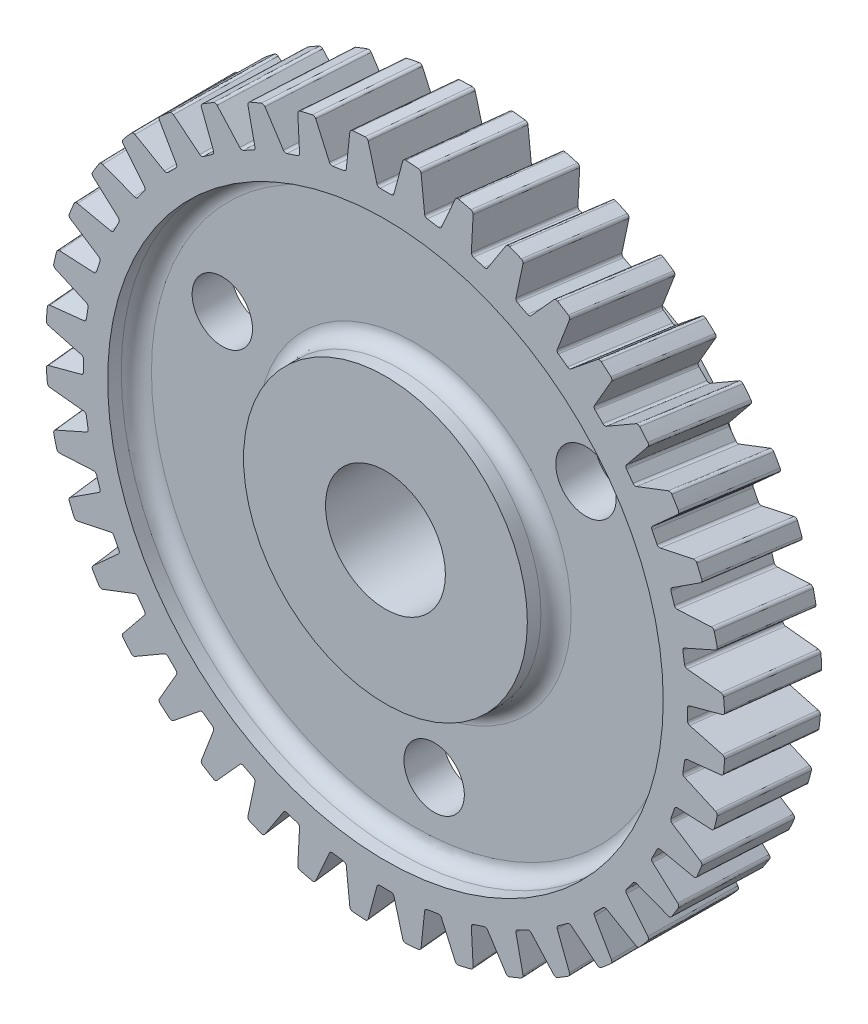
from build123d import *

# Parameters (mm, degrees)
FILLET1_R                = 1
CIRPATTERN1_COUNT        = 40
FILLET2_R                = 0.2
F_4_0_4_DIAMETER_HOLE1_D = 4


with BuildPart() as part:
    # Sketch2 → Revolve1 (revolve)
    with BuildSketch(Plane(origin=(0, 0, 0), x_dir=(0, 0, -1), z_dir=(1, 0, 0))):
        Polygon((11, 3.96875), (-3.2, 3.96875), (-3.2, 9.4), (-1.3, 9.4), (-1.3, 18.4), (-3.2, 18.4), (-3.2, 22.5), (3.2, 22.5), (3.2, 18.4), (1.3, 18.4), (1.3, 9.4), (3.2, 9.4), (11, 9.4), align=None)
    revolve(axis=Axis((0, 0, 0), (0, 0, -1)))

    # Fillet1
    fillet1_edges = [part.edges().sort_by_distance(p)[0] for p in [
        (0, -18.4, 1.3),
        (0, -9.4, 1.3),
        (0, -9.4, -1.3),
        (0, -18.4, -1.3),
    ]]
    fillet(fillet1_edges, radius=FILLET1_R)

    # Cut-Sweep1: sweep along a path in Sketch4
    with BuildLine(Plane(origin=(0, 0, 0), x_dir=(1, 0, 0), z_dir=(0, 1, 0))) as cut_sweep1_path:
        Line((0, -3.2), (0.690971205, 3.2))
    # Sketch3 → Cut-Sweep1 (sweep, cut)
    with BuildSketch(Plane.XY.offset(3.2)):
        Polygon((-0.525, 20), (0.525, 20), (1.246362285, 22.6921607), (-1.246362285, 22.6921607), align=None)
    cut_sweep1 = sweep(path=cut_sweep1_path.line, mode=Mode.SUBTRACT)

    # CirPattern1: Cut-Sweep1 ×40 about axis
    cirpattern1_axis = Axis((0, 0, 3.2), (0, 0, 1))
    for i in range(1, CIRPATTERN1_COUNT):
        add(cut_sweep1.rotate(cirpattern1_axis, i * 360 / CIRPATTERN1_COUNT), mode=Mode.SUBTRACT)

    # Fillet2
    fillet2_edges = [part.edges().sort_by_distance(p)[0] for p in [
        (1.526462518, 22.448160552, 5.3054e-05),
        (0.870485603, 20, 0),
        (-0.845126217, 22.484122435, -6.2808e-05),
        (-2.003996756, 22.410577793, 5.3054e-05),
        (-2.26892082, 19.889940761, 0),
        (-3.305993578, 19.725684573, 0),
        (-4.352012976, 22.07509871, -6.2808e-05),
        (-5.485110979, 21.821172231, 5.3054e-05),
        (-5.352458883, 19.29012517, 0),
        (-6.351068225, 18.965657326, 0),
        (-7.751738732, 21.122512792, -6.2808e-05),
        (-8.831163565, 20.694456989, 5.3054e-05),
        (-8.304201644, 18.215322678, 0),
        (-9.239758494, 17.738632653, 0),
        (-10.960590953, 19.649820507, -6.2808e-05),
        (-11.959763596, 19.058175535, 5.3054e-05),
        (-11.0514674, 16.691998487, 0),
        (-11.900935244, 16.074823972, 0),
        (-13.89955705, 17.693284427, -6.2808e-05),
        (-14.793874554, 16.952618549, 5.3054e-05),
        (-13.526609351, 14.757661896, 0),
        (-14.269071471, 14.015199776, 0),
        (-16.496269922, 15.301080964, -6.2808e-05),
        (-17.263711223, 14.429631832, 5.3054e-05),
        (-15.668681288, 12.459942692, 0),
        (-16.285855803, 11.610474848, 0),
        (-18.68678988, 12.532114106, -6.2808e-05),
        (-19.308458027, 11.55133969, 5.3054e-05),
        (-17.42493829, 9.855418346, 0),
        (-17.901628315, 8.919861496, 0),
        (-20.417179054, 9.454565008, -6.2808e-05),
        (-20.877766513, 8.388615227, 5.3054e-05),
        (-18.752135481, 7.008220892, 0),
        (-19.076603325, 6.00961155, 0),
        (-21.644829518, 6.144213141, -6.2808e-05),
        (-21.932995098, 5.019335218, 5.3054e-05),
        (-19.617592862, 3.988457781, 0),
        (-19.781849051, 2.951385024, 0),
        (-22.339512445, 2.682570354, -6.2808e-05),
        (-22.448160552, 1.526462518, 5.3054e-05),
        (-20, 0.870485603, 0),
        (-20, -0.179514397, 0),
        (-22.484122435, -0.845126217, -6.2808e-05),
        (-22.410577793, -2.003996756, 5.3054e-05),
        (-19.889940761, -2.26892082, 0),
        (-19.725684573, -3.305993578, 0),
        (-22.07509871, -4.352012976, -6.2808e-05),
        (-21.821172231, -5.485110979, 5.3054e-05),
        (-19.29012517, -5.352458883, 0),
        (-18.965657326, -6.351068225, 0),
        (-21.122512792, -7.751738732, -6.2808e-05),
        (-20.694456989, -8.831163565, 5.3054e-05),
        (-18.215322678, -8.304201644, 0),
        (-17.738632653, -9.239758494, 0),
        (-19.649820507, -10.960590953, -6.2808e-05),
        (-19.058175535, -11.959763596, 5.3054e-05),
        (-16.691998487, -11.0514674, 0),
        (-16.074823972, -11.900935244, 0),
        (-17.693284427, -13.89955705, -6.2808e-05),
        (-16.952618549, -14.793874554, 5.3054e-05),
        (-14.757661896, -13.526609351, 0),
        (-14.015199776, -14.269071471, 0),
        (-15.301080964, -16.496269922, -6.2808e-05),
        (-14.429631832, -17.263711223, 5.3054e-05),
        (-12.459942692, -15.668681288, 0),
        (-11.610474848, -16.285855803, 0),
        (-12.532114106, -18.68678988, -6.2808e-05),
        (-11.55133969, -19.308458027, 5.3054e-05),
        (-9.855418346, -17.42493829, 0),
        (-8.919861496, -17.901628315, 0),
        (-9.454565008, -20.417179054, -6.2808e-05),
        (-8.388615227, -20.877766513, 5.3054e-05),
        (-7.008220892, -18.752135481, 0),
        (-6.00961155, -19.076603325, 0),
        (-6.144213141, -21.644829518, -6.2808e-05),
        (-5.019335218, -21.932995098, 5.3054e-05),
        (-3.988457781, -19.617592862, 0),
        (-2.951385024, -19.781849051, 0),
        (-2.682570354, -22.339512445, -6.2808e-05),
        (-1.526462518, -22.448160552, 5.3054e-05),
        (-0.870485603, -20, 0),
        (0.179514397, -20, 0),
        (0.845126217, -22.484122435, -6.2808e-05),
        (2.003996756, -22.410577793, 5.3054e-05),
        (2.26892082, -19.889940761, 0),
        (3.305993578, -19.725684573, 0),
        (4.352012976, -22.07509871, -6.2808e-05),
        (5.485110979, -21.821172231, 5.3054e-05),
        (5.352458883, -19.29012517, 0),
        (6.351068225, -18.965657326, 0),
        (7.751738732, -21.122512792, -6.2808e-05),
        (8.831163565, -20.694456989, 5.3054e-05),
        (8.304201644, -18.215322678, 0),
        (9.239758494, -17.738632653, 0),
        (10.960590953, -19.649820507, -6.2808e-05),
        (11.959763596, -19.058175535, 5.3054e-05),
        (11.0514674, -16.691998487, 0),
        (11.900935244, -16.074823972, 0),
        (13.89955705, -17.693284427, -6.2808e-05),
        (14.793874554, -16.952618549, 5.3054e-05),
        (13.526609351, -14.757661896, 0),
        (14.269071471, -14.015199776, 0),
        (16.496269922, -15.301080964, -6.2808e-05),
        (17.263711223, -14.429631832, 5.3054e-05),
        (15.668681288, -12.459942692, 0),
        (16.285855803, -11.610474848, 0),
        (18.68678988, -12.532114106, -6.2808e-05),
        (19.308458027, -11.55133969, 5.3054e-05),
        (17.42493829, -9.855418346, 0),
        (17.901628315, -8.919861496, 0),
        (20.417179054, -9.454565008, -6.2808e-05),
        (20.877766513, -8.388615227, 5.3054e-05),
        (18.752135481, -7.008220892, 0),
        (19.076603325, -6.00961155, 0),
        (21.644829518, -6.144213141, -6.2808e-05),
        (21.932995098, -5.019335218, 5.3054e-05),
        (19.617592862, -3.988457781, 0),
        (19.781849051, -2.951385024, 0),
        (22.339512445, -2.682570354, -6.2808e-05),
        (22.448160552, -1.526462518, 5.3054e-05),
        (20, -0.870485603, 0),
        (20, 0.179514397, 0),
        (22.484122435, 0.845126217, -6.2808e-05),
        (22.410577793, 2.003996756, 5.3054e-05),
        (19.889940761, 2.26892082, 0),
        (19.725684573, 3.305993578, 0),
        (22.07509871, 4.352012976, -6.2808e-05),
        (21.821172231, 5.485110979, 5.3054e-05),
        (19.29012517, 5.352458883, 0),
        (18.965657326, 6.351068225, 0),
        (21.122512792, 7.751738732, -6.2808e-05),
        (20.694456989, 8.831163565, 5.3054e-05),
        (18.215322678, 8.304201644, 0),
        (17.738632653, 9.239758494, 0),
        (19.649820507, 10.960590953, -6.2808e-05),
        (19.058175535, 11.959763596, 5.3054e-05),
        (16.691998487, 11.0514674, 0),
        (16.074823972, 11.900935244, 0),
        (17.693284427, 13.89955705, -6.2808e-05),
        (16.952618549, 14.793874554, 5.3054e-05),
        (14.757661896, 13.526609351, 0),
        (14.015199776, 14.269071471, 0),
        (15.301080964, 16.496269922, -6.2808e-05),
        (14.429631832, 17.263711223, 5.3054e-05),
        (12.459942692, 15.668681288, 0),
        (11.610474848, 16.285855803, 0),
        (12.532114106, 18.68678988, -6.2808e-05),
        (11.55133969, 19.308458027, 5.3054e-05),
        (9.855418346, 17.42493829, 0),
        (8.919861496, 17.901628315, 0),
        (9.454565008, 20.417179054, -6.2808e-05),
        (8.388615227, 20.877766513, 5.3054e-05),
        (7.008220892, 18.752135481, 0),
        (6.00961155, 19.076603325, 0),
        (6.144213141, 21.644829518, -6.2808e-05),
        (5.019335218, 21.932995098, 5.3054e-05),
        (3.988457781, 19.617592862, 0),
        (2.951385024, 19.781849051, 0),
        (2.682570354, 22.339512445, -6.2808e-05),
        (-0.179514397, 20, 0),
    ]]
    fillet(fillet2_edges, radius=FILLET2_R)

    # Ø4.0 (4) Diameter Hole1 (through all)
    with Locations(Plane(origin=(59.759048418, -178.20301315, 3.9366), x_dir=(0.9999854958897523, -0.005385908477352911, 0), z_dir=(0, 0, 1))):
        with Locations((-73.454863948, 183.614199593), (-49.38231875, 186.041234274), (-59.31671766, 163.980281258)):
            Hole(F_4_0_4_DIAMETER_HOLE1_D / 2)


solid = part.part
